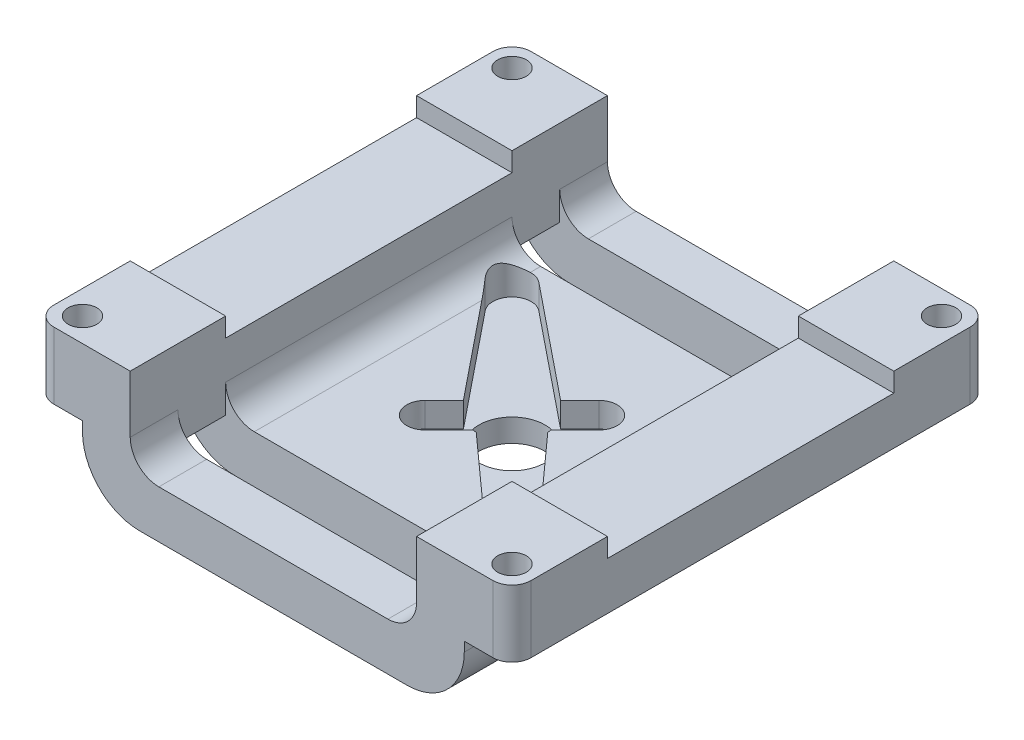
from build123d import *

# Parameters (mm, degrees)
EXTRUDE_1_DEPTH     = 50
SKETCH_2_R          = 3.45
CUT_EXTRUDE_1_DEPTH = 50
SKETCH_3_W          = 10
SKETCH_3_H          = 10
EXTRUDE_2_DEPTH     = 2
FILLET_1_R          = 6
FILLET_2_R          = 6
FILLET_3_R          = 3
FILLET_4_R          = 3
SKETCH_5_R          = 1.5
CUT_EXTRUDE_2_DEPTH = 23
FILLET_5_R          = 2
FILLET_6_R          = 2
FILLET_7_R          = 2
FILLET_8_R          = 2
SKETCH_7_W          = 44.35766487
SKETCH_7_H          = 5
CUT_EXTRUDE_4_DEPTH = 5
SKETCH_8_W          = 30
SKETCH_8_H          = 5
CUT_EXTRUDE_5_DEPTH = 31
CUT_EXTRUDE_6_DEPTH = 2.6


with BuildPart() as part:
    # 草图1 → 凸台-拉伸1 (new body)
    with BuildSketch(Plane.XY):
        Polygon((-45, 4.380640832), (-35, 4.380640832), (-35, -2.619359168), (-5, -2.619359168), (-5, 4.380640832), (5, 4.380640832), (5, -0.619359168), (0, -0.619359168), (0, -7.619359168), (-40, -7.619359168), (-40, -0.619359168), (-45, -0.619359168), align=None)
    extrude(amount=EXTRUDE_1_DEPTH)

    # 草图2 → 切除-拉伸1 (cut)
    with BuildSketch(Plane(origin=(0, -2.619359168, 0), x_dir=(1, 0, 0), z_dir=(0, 1, 0))):
        with Locations((-20, -25)):
            Circle(SKETCH_2_R)
    extrude(amount=-CUT_EXTRUDE_1_DEPTH, mode=Mode.SUBTRACT)

    # 草图3 → 凸台-拉伸2 (add)
    with BuildSketch(Plane(origin=(0, 4.380640832, 0), x_dir=(1, 0, 0), z_dir=(0, 1, 0))):
        with Locations((0, -45)):
            Rectangle(SKETCH_3_W, SKETCH_3_H)
        with Locations((-40, -45)):
            Rectangle(SKETCH_3_W, SKETCH_3_H)
        with Locations((-40, -5)):
            Rectangle(SKETCH_3_W, SKETCH_3_H)
        with Locations((0, -5)):
            Rectangle(SKETCH_3_W, SKETCH_3_H)
    extrude(amount=EXTRUDE_2_DEPTH)

    # 圆角1
    fillet_1_edges = [part.edges().sort_by_distance(p)[0] for p in [
        (-40, -7.619359168, 25),
    ]]
    fillet(fillet_1_edges, radius=FILLET_1_R)

    # 圆角2
    fillet_2_edges = [part.edges().sort_by_distance(p)[0] for p in [
        (0, -7.619359168, 25),
    ]]
    fillet(fillet_2_edges, radius=FILLET_2_R)

    # 圆角3
    fillet_3_edges = [part.edges().sort_by_distance(p)[0] for p in [
        (-5, -2.619359168, 25),
    ]]
    fillet(fillet_3_edges, radius=FILLET_3_R)

    # 圆角4
    fillet_4_edges = [part.edges().sort_by_distance(p)[0] for p in [
        (-35, -2.619359168, 25),
    ]]
    fillet(fillet_4_edges, radius=FILLET_4_R)

    # 草图5 → 切除-拉伸2 (cut)
    with BuildSketch(Plane.XZ.offset(0.619359168)):
        with Locations((2.5, 47.5)):
            Circle(SKETCH_5_R)
        with Locations((2.5, 2.5)):
            Circle(SKETCH_5_R)
        with Locations((-42.5, 2.5)):
            Circle(SKETCH_5_R)
        with Locations((-42.5, 47.5)):
            Circle(SKETCH_5_R)
    extrude(amount=-CUT_EXTRUDE_2_DEPTH, mode=Mode.SUBTRACT)

    # 圆角5
    fillet_5_edges = [part.edges().sort_by_distance(p)[0] for p in [
        (5, 2.880640832, 50),
    ]]
    fillet(fillet_5_edges, radius=FILLET_5_R)

    # 圆角6
    fillet_6_edges = [part.edges().sort_by_distance(p)[0] for p in [
        (5, 2.880640832, 0),
    ]]
    fillet(fillet_6_edges, radius=FILLET_6_R)

    # 圆角7
    fillet_7_edges = [part.edges().sort_by_distance(p)[0] for p in [
        (-45, 2.880640832, 0),
    ]]
    fillet(fillet_7_edges, radius=FILLET_7_R)

    # 圆角8
    fillet_8_edges = [part.edges().sort_by_distance(p)[0] for p in [
        (-45, 2.880640832, 50),
    ]]
    fillet(fillet_8_edges, radius=FILLET_8_R)

    # 草图7 → 切除-拉伸4 (cut)
    with BuildSketch(Plane.XZ.offset(7.619359168)):
        with Locations((-20.290282059, 42.5)):
            Rectangle(SKETCH_7_W, SKETCH_7_H)
        with Locations((-20.290282059, 7.5)):
            Rectangle(SKETCH_7_W, SKETCH_7_H)
    extrude(amount=-CUT_EXTRUDE_4_DEPTH, mode=Mode.SUBTRACT)

    # 草图8 → 切除-拉伸5 (cut)
    with BuildSketch(Plane(origin=(0, 6.380640832, 0), x_dir=(1, 0, 0), z_dir=(0, 1, 0))):
        with Locations((-20, -42.5)):
            Rectangle(SKETCH_8_W, SKETCH_8_H)
        with Locations((-20, -7.5)):
            Rectangle(SKETCH_8_W, SKETCH_8_H)
    extrude(amount=-CUT_EXTRUDE_5_DEPTH, mode=Mode.SUBTRACT)

    # 草图9 → 切除-拉伸6 (cut, symmetric)
    with BuildSketch(Plane(origin=(0, -2.619359168, 0), x_dir=(1, 0, 0), z_dir=(0, 1, 0))):
        with BuildLine():
            Line((-16.782664146, -19.095658377), (-18.797918472, -21.110912703))
            Line((-18.797918472, -21.110912703), (-30.657901432, -11.529508621))
            ThreePointArc((-30.657901432, -11.529508621), (-33.328962825, -11.671037175), (-33.470491379, -14.342098568))
            Line((-33.470491379, -14.342098568), (-23.889087297, -26.202081528))
            Line((-23.889087297, -26.202081528), (-25.904341623, -28.217335854))
            ThreePointArc((-25.904341623, -28.217335854), (-25.904341623, -30.904341623), (-23.217335854, -30.904341623))
            Line((-23.217335854, -30.904341623), (-20.692731385, -28.379737154))
            ThreePointArc((-20.692731385, -28.379737154), (-20.502761268, -28.413170243), (-20.311219553, -28.435933991))
            Line((-20.311219553, -28.435933991), (-11.119920275, -36.704565799))
            ThreePointArc((-11.119920275, -36.704565799), (-8.368093449, -36.631906551), (-8.295434201, -33.880079725))
            Line((-8.295434201, -33.880079725), (-16.564066009, -24.688780447))
            ThreePointArc((-16.564066009, -24.688780447), (-16.586829757, -24.497238732), (-16.620262846, -24.307268615))
            Line((-16.620262846, -24.307268615), (-14.095658377, -21.782664146))
            ThreePointArc((-14.095658377, -21.782664146), (-14.095658377, -19.095658377), (-16.782664146, -19.095658377))
        make_face()
    extrude(amount=CUT_EXTRUDE_6_DEPTH, both=True, mode=Mode.SUBTRACT)


solid = part.part
